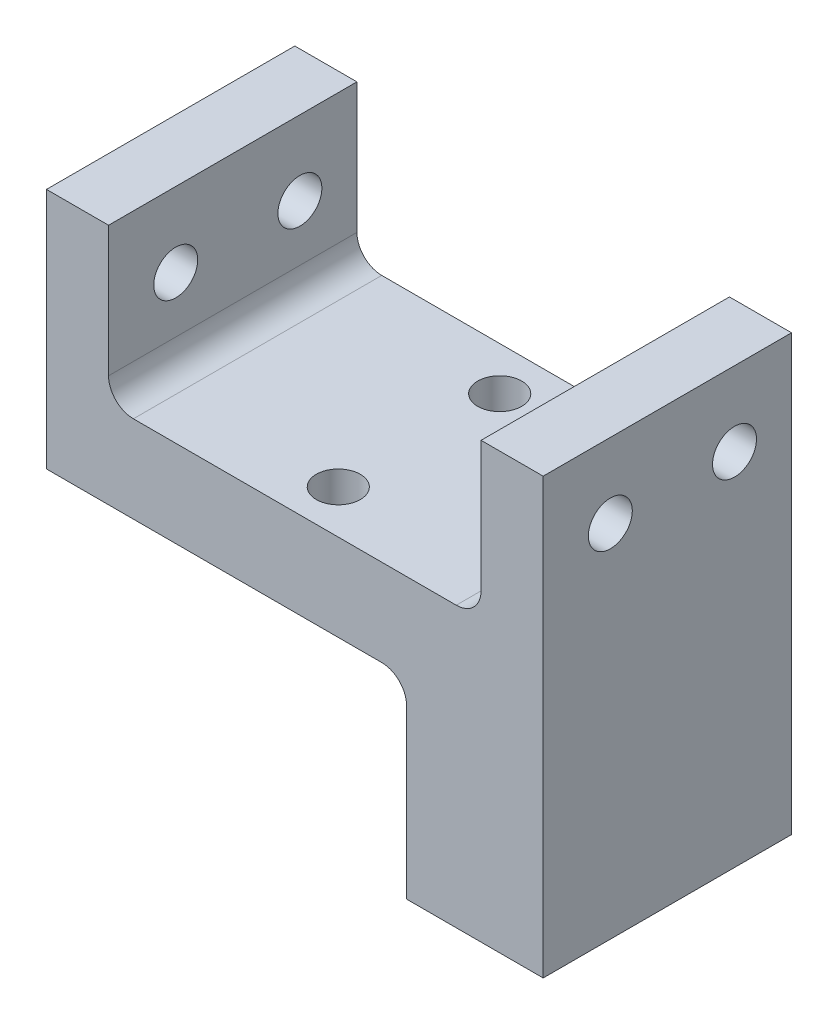
from build123d import *

# Parameters (mm, degrees)
SKETCH1_W                    = 50.8
SKETCH1_H                    = 25.4
BOSS_EXTRUDE1_DEPTH          = 44.45
SKETCH8_W                    = 38.1
SKETCH8_H                    = 15.875
SKETCH8_W_2                  = 36.83
SKETCH8_H_2                  = 19.685
CUT_EXTRUDE1_DEPTH           = 58.15
F_8_CLEARANCE_HOLE3_D        = 4.4958
F_8_CLEARANCE_HOLE2_D        = 4.4958
F_1_8_0_18_DOWEL_HOLE1_D     = 4.572
F_1_8_0_18_DOWEL_HOLE1_DEPTH = 7.62
F_1_8_0_18_DOWEL_HOLE1_TIP   = 1.373567375
FILLET1_R                    = 2.54


with BuildPart() as part:
    # Sketch1 → Boss-Extrude1 (new body)
    with BuildSketch(Plane(origin=(0, 0, 0), x_dir=(1, 0, 0), z_dir=(0, 1, 0))):
        Rectangle(SKETCH1_W, SKETCH1_H)
    extrude(amount=BOSS_EXTRUDE1_DEPTH)

    # Sketch8 → Cut-Extrude1 (cut, through all)
    with BuildSketch(Plane.XY.offset(12.7)):
        with Locations((0, 36.5125)):
            Rectangle(SKETCH8_W, SKETCH8_H)
        with Locations((-6.985, 9.8425)):
            Rectangle(SKETCH8_W_2, SKETCH8_H_2)
    extrude(amount=-CUT_EXTRUDE1_DEPTH, mode=Mode.SUBTRACT)

    # #8 Clearance Hole3 (through all)
    with Locations(Plane(origin=(25.4, 0, 0), x_dir=(0, 0, -1), z_dir=(1, 0, 0))):
        with Locations((6.868185943, 36.83), (-5.831814057, 36.83)):
            Hole(F_8_CLEARANCE_HOLE3_D / 2)

    # #8 Clearance Hole2 (through all)
    with Locations(Plane(origin=(0, 28.575, 0), x_dir=(1, 0, 0), z_dir=(0, 1, 0))):
        with Locations((0, 8.255), (0, -8.255)):
            Hole(F_8_CLEARANCE_HOLE2_D / 2)

    # 1/8 (0.18) Dowel Hole1
    with Locations(Plane.ZY.offset(-11.43)):
        with Locations((2.916276039, 6.096)):
            Hole(F_1_8_0_18_DOWEL_HOLE1_D / 2, depth=F_1_8_0_18_DOWEL_HOLE1_DEPTH)
            with Locations((0, 0, -(F_1_8_0_18_DOWEL_HOLE1_DEPTH + F_1_8_0_18_DOWEL_HOLE1_TIP / 2))):  # 118° drill point
                Cone(0, F_1_8_0_18_DOWEL_HOLE1_D / 2, F_1_8_0_18_DOWEL_HOLE1_TIP, mode=Mode.SUBTRACT)

    # Fillet1
    fillet1_edges = [part.edges().sort_by_distance(p)[0] for p in [
        (11.43, 19.685, 0),
        (-19.05, 28.575, 0),
        (19.05, 28.575, 0),
    ]]
    fillet(fillet1_edges, radius=FILLET1_R)


solid = part.part
